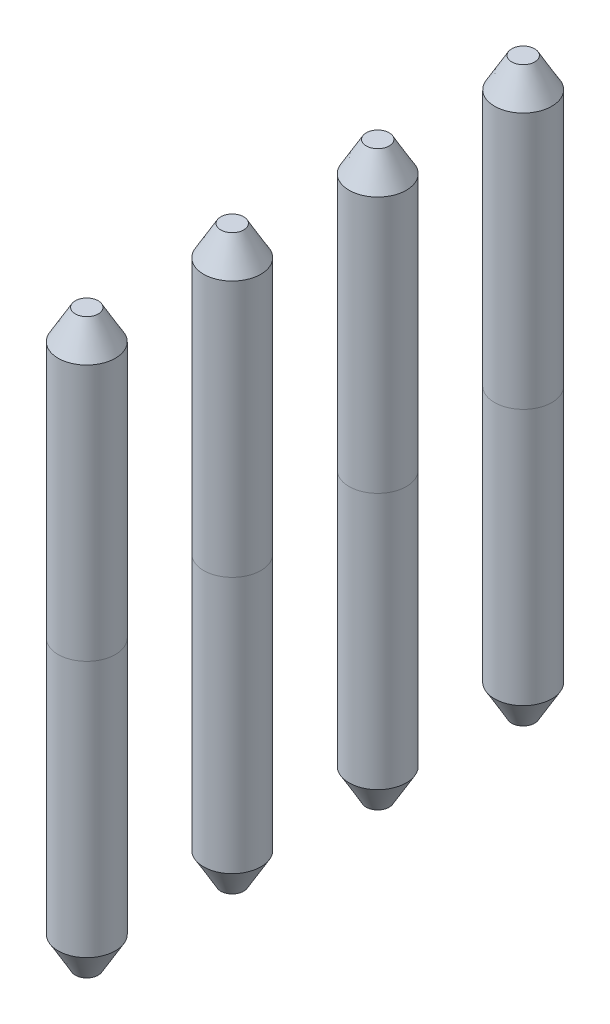
from build123d import *
from OCP.BRepFilletAPI import BRepFilletAPI_MakeChamfer

# Parameters (mm, degrees)
SWEEP1_START     = -4.300813064
SWEEP1_OUTLINE_R = 0.5
SWEEP1_DEPTH     = 10
CHAMFER1_SIZE    = 0.3
CHAMFER1_SIZE2   = 0.519615242
LPATTERN1_COUNT  = 4
LPATTERN1_PITCH  = 2.54


# Read off the part's stored shape, not the designer's step: Sweep1
with BuildPart() as part:
    # Sweep1 outline → Sweep1 (new body)
    with BuildSketch(Plane(origin=(0, 0, 0), x_dir=(1, 0, 0), z_dir=(0, 1, 0)).offset(SWEEP1_START)):
        Circle(SWEEP1_OUTLINE_R)
    extrude(amount=SWEEP1_DEPTH)

    # Chamfer1: one chamfer whose edges measure the first distance from different faces: ONE call of the kernel's chamfer builder (chamfer() names one face for all edges)
    chamfer1_edges_1 = [part.edges().sort_by_distance(p)[0] for p in [
        (-0.5, -4.300813064, 0),
    ]]
    chamfer1_side_1 = [part.faces().sort_by_distance(p)[0] for p in [
        (0, -4.300813064, 0),
    ]]
    chamfer1_edges_2 = [part.edges().sort_by_distance(p)[0] for p in [
        (-0.5, 5.699186936, 0),
    ]]
    chamfer1_side_2 = [part.faces().sort_by_distance(p)[0] for p in [
        (0, 5.699186936, 0),
    ]]
    chamfer1 = BRepFilletAPI_MakeChamfer(part.part.solid().wrapped)
    for e in chamfer1_edges_1:
        chamfer1.Add(CHAMFER1_SIZE, CHAMFER1_SIZE2, e.wrapped, chamfer1_side_1[0].wrapped)  # the first distance lies on this face
    for e in chamfer1_edges_2:
        chamfer1.Add(CHAMFER1_SIZE, CHAMFER1_SIZE2, e.wrapped, chamfer1_side_2[0].wrapped)  # the first distance lies on this face
    add(Compound.cast(chamfer1.Shape()), mode=Mode.REPLACE)


with BuildPart() as lpattern1_1:
    # LPattern1: pattern copy
    add(part.part.moved(Location(Vector(0, 0, 1) * (1 * LPATTERN1_PITCH))))


with BuildPart() as lpattern1_2:
    # LPattern1: pattern copy
    add(part.part.moved(Location(Vector(0, 0, 1) * (2 * LPATTERN1_PITCH))))


with BuildPart() as lpattern1_3:
    # LPattern1: pattern copy
    add(part.part.moved(Location(Vector(0, 0, 1) * (3 * LPATTERN1_PITCH))))


solid = Compound([part.part, lpattern1_1.part, lpattern1_2.part, lpattern1_3.part])
